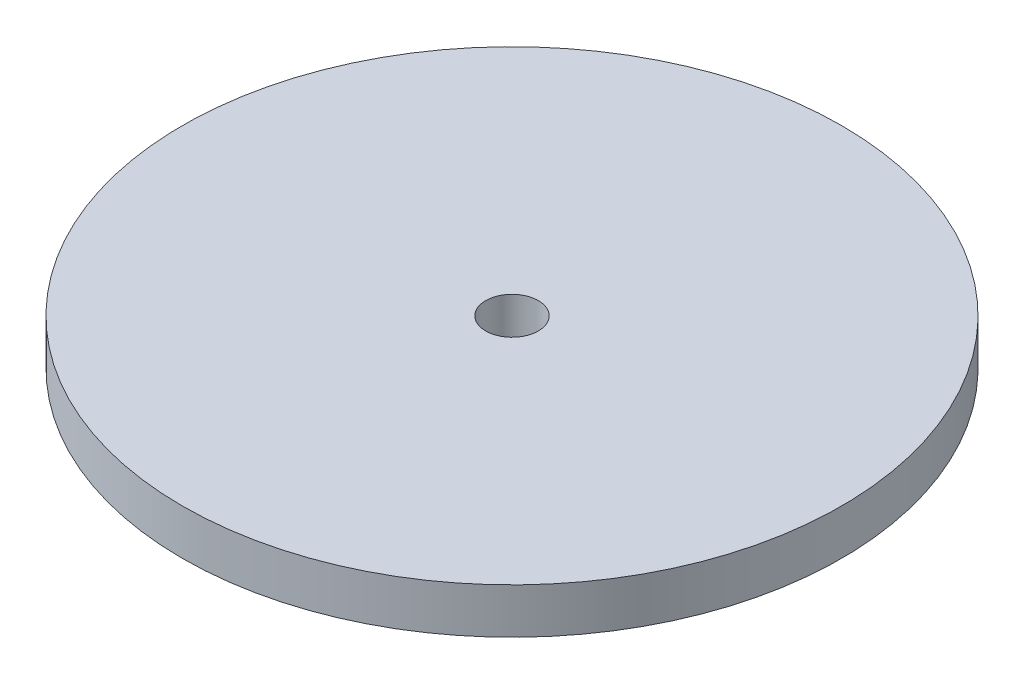
from build123d import *

# Parameters (mm, degrees)
SKETCH1_R           = 36.3
SKETCH1_R_2         = 2.9
BOSS_EXTRUDE1_DEPTH = 5


with BuildPart() as part:
    # Sketch1 → Boss-Extrude1 (new body)
    with BuildSketch(Plane(origin=(0, 0, 0), x_dir=(1, 0, 0), z_dir=(0, 1, 0))):
        Circle(SKETCH1_R)
        Circle(SKETCH1_R_2, mode=Mode.SUBTRACT)
    extrude(amount=BOSS_EXTRUDE1_DEPTH)


solid = part.part
